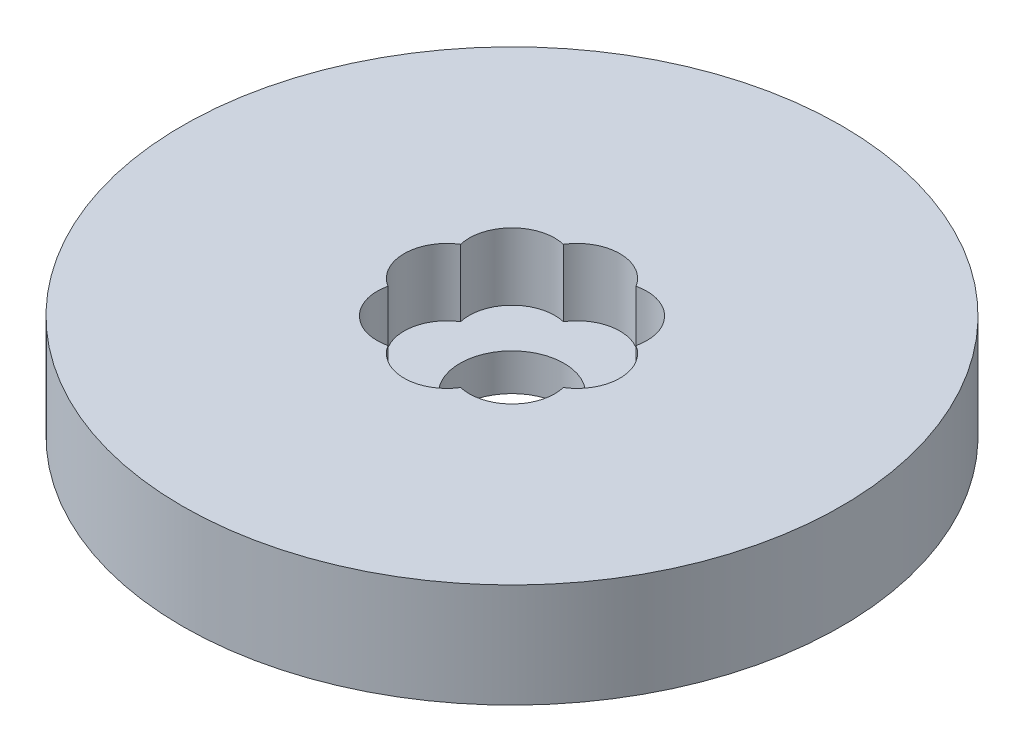
from build123d import *

# Parameters (mm, degrees)
SKETCH1_R           = 47.5
BOSS_EXTRUDE1_DEPTH = 15
SKETCH2_R           = 7.5
CUT_EXTRUDE1_DEPTH  = 69.82949949
SKETCH3_R           = 6.163606018
CUT_EXTRUDE2_DEPTH  = 9.66154367
CIRPATTERN1_COUNT   = 8


with BuildPart() as part:
    # Sketch1 → Boss-Extrude1 (new body)
    with BuildSketch(Plane(origin=(0, 0, 0), x_dir=(1, 0, 0), z_dir=(0, 1, 0))):
        Circle(SKETCH1_R)
    extrude(amount=BOSS_EXTRUDE1_DEPTH)

    # Sketch2 → Cut-Extrude1 (cut, through all)
    with BuildSketch(Plane(origin=(0, 0, 0), x_dir=(1, 0, 0), z_dir=(0, 1, 0))):
        Circle(SKETCH2_R)
    extrude(amount=CUT_EXTRUDE1_DEPTH, mode=Mode.SUBTRACT)

    # Sketch3 → Cut-Extrude2 (cut)
    with BuildSketch(Plane(origin=(0, 15, 0), x_dir=(1, 0, 0), z_dir=(0, 1, 0))):
        with Locations((-9.390625739, 0)):
            Circle(SKETCH3_R)
    cut_extrude2 = extrude(amount=-CUT_EXTRUDE2_DEPTH, mode=Mode.SUBTRACT)

    # CirPattern1: Cut-Extrude2 ×8 about axis
    cirpattern1_axis = Axis((0, 0, 0), (0, 1, 0))
    for i in range(1, CIRPATTERN1_COUNT):
        add(cut_extrude2.rotate(cirpattern1_axis, i * 360 / CIRPATTERN1_COUNT), mode=Mode.SUBTRACT)


solid = part.part
